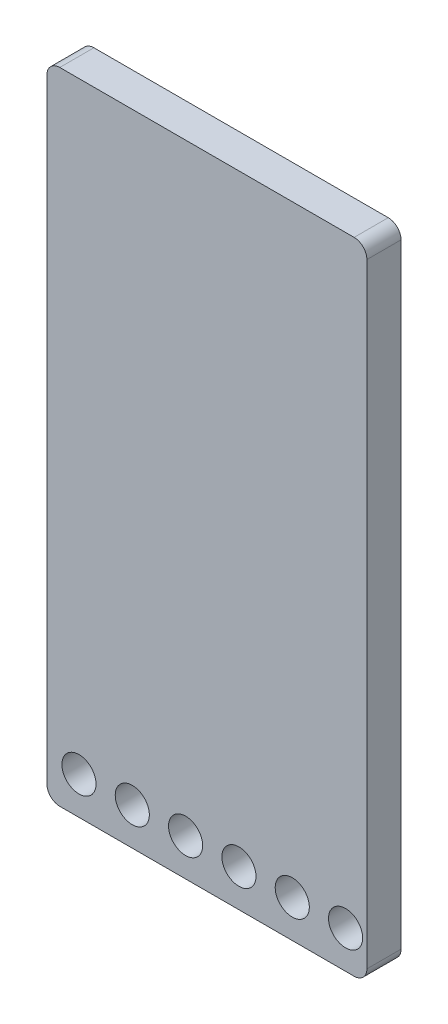
from build123d import *

# Parameters (mm, degrees)
Y_KSEKLIK_EKSTR_ZYON1_DEPTH = 1.6
IZIM3_R                     = 0.8
KES_EKSTR_ZYON1_DEPTH       = 1.6


with BuildPart() as part:
    # Çizim1 → Yükseklik-Ekstrüzyon1 (new body)
    with BuildSketch(Plane.XY):
        with BuildLine():
            Line((-6.9, -15), (6.9, -15))
            ThreePointArc((6.9, -15), (7.324264069, -14.824264069), (7.5, -14.4))
            Line((7.5, -14.4), (7.5, 14.4))
            ThreePointArc((7.5, 14.4), (7.324264069, 14.824264069), (6.9, 15))
            Line((6.9, 15), (-6.9, 15))
            ThreePointArc((-6.9, 15), (-7.324264069, 14.824264069), (-7.5, 14.4))
            Line((-7.5, 14.4), (-7.5, -14.4))
            ThreePointArc((-7.5, -14.4), (-7.324264069, -14.824264069), (-6.9, -15))
        make_face()
    extrude(amount=Y_KSEKLIK_EKSTR_ZYON1_DEPTH)

    # Çizim3 → Kes-Ekstrüzyon1 (cut)
    with BuildSketch(Plane(origin=(0, 0, 0), x_dir=(-1, 0, 0), z_dir=(0, 0, -1))):
        with Locations((-6.5, -13.247254212)):
            Circle(IZIM3_R)
        with Locations((-4, -13.247254212)):
            Circle(IZIM3_R)
        with Locations((-1.5, -13.247254212)):
            Circle(IZIM3_R)
        with Locations((1, -13.247254212)):
            Circle(IZIM3_R)
        with Locations((3.5, -13.247254212)):
            Circle(IZIM3_R)
        with Locations((6, -13.247254212)):
            Circle(IZIM3_R)
    extrude(amount=-KES_EKSTR_ZYON1_DEPTH, mode=Mode.SUBTRACT)


solid = part.part
